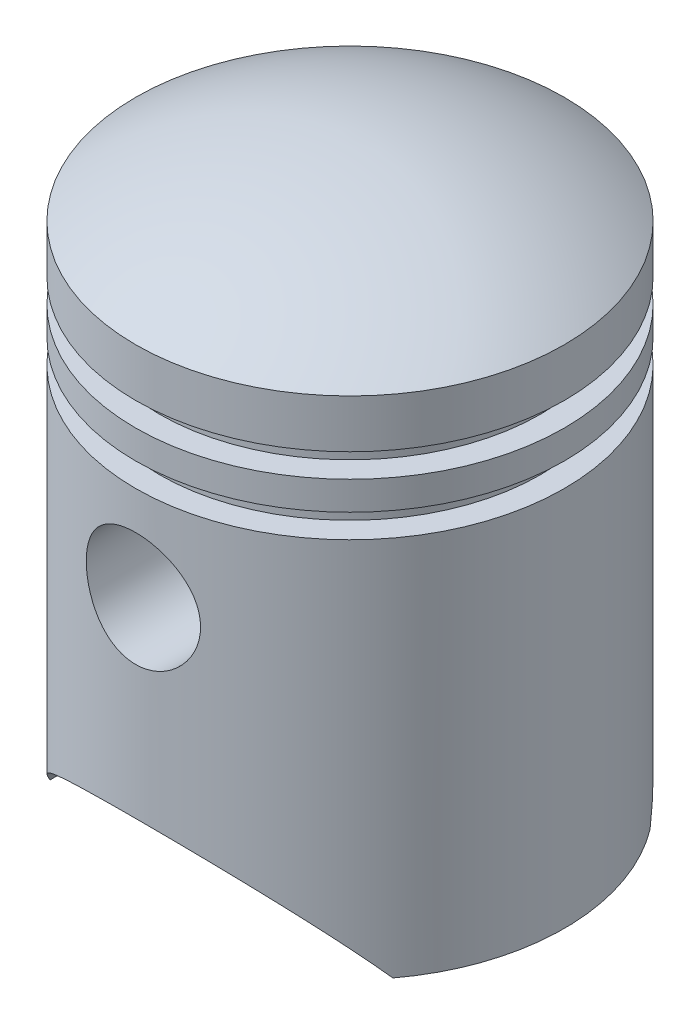
from build123d import *

# Parameters (mm, degrees)
SZKIC3_W                         = 2.5
SZKIC3_H                         = 2.5
SZYK_LINIOWY1_COUNT              = 2
SZYK_LINIOWY1_PITCH              = 5.5
WYTNIJ_WYCI_GNI_CIE1_DEPTH       = 68.915388536
WYTNIJ_WYCI_GNI_CIE1_DEPTH_BACK  = 68.915388536
WYTNIJ_WYCI_GNI_CIE3_DEPTH       = 68.915388602
WYTNIJ_WYCI_GNI_CIE3_DEPTH_BACK  = 68.915388602
SZKIC5_R                         = 6
DODANIE_WYCI_GNI_CIE1_REACH      = 79.915
DODANIE_WYCI_GNI_CIE1_END_RADIUS = 20.5
DODANIE_WYCI_GNI_CIE1_START      = 10
SZKIC6_R                         = 7.5
SZKIC6_R_2                       = 6


# Read off the part's stored shape, not the designer's step: Skorupa1
with BuildPart() as part:
    # Szkic1 → Obrót1 (revolve)
    with BuildSketch(Plane.XY):
        with BuildLine():
            Line((0, 0), (0, 60))
            ThreePointArc((0, 60), (11.771243445, 58.228756555), (22.5, 53.071891388))
            Line((22.5, 53.071891388), (22.5, 0))
            Line((22.5, 0), (0, 0))
        make_face()
    revolve(axis=Axis((0, 0, 0), (0, 1, 0)))

    # Szkic3 → Wycięcie-obrót1 (revolve, cut)
    with BuildSketch(Plane.XY, mode=Mode.PRIVATE) as wyci_cie_obr_t1_sk:
        with Locations((21.25, 41.25)):
            Rectangle(SZKIC3_W, SZKIC3_H)
    wyci_cie_obr_t1 = revolve(wyci_cie_obr_t1_sk.sketch.rotate(Axis((0, 69.339068265, 0), (0, 1, 0)), 90), axis=Axis((0, 69.339068265, 0), (0, 1, 0)), mode=Mode.SUBTRACT)

    # Szyk liniowy1: Wycięcie-obrót1 ×2
    with Locations(*[(0, i * SZYK_LINIOWY1_PITCH, 0) for i in range(1, SZYK_LINIOWY1_COUNT)]):
        add(wyci_cie_obr_t1, mode=Mode.SUBTRACT)

    # Skorupa1 outline → Skorupa1 (revolve, cut)
    with BuildSketch(Plane.XY):
        with BuildLine():
            Line((20.5, 0), (20.5, 38))
            Line((20.5, 38), (18, 38))
            Line((18, 38), (18, 50))
            Line((18, 50), (20.5, 50))
            Line((20.5, 50), (20.500000011, 51.996093505))
            ThreePointArc((20.500000011, 51.996093505), (10.680553516, 56.468147425), (0, 58))
            Line((0, 58), (0, 0))
            Line((0, 0), (20.5, 0))
        make_face()
    revolve(axis=Axis((0, 0, 0), (0, 1, 0)), mode=Mode.SUBTRACT)

    # Szkic4 → Wytnij-wyciągnięcie1 (cut, two sides: drawn at the far end of the back side and taken through both)
    with BuildSketch(Plane.XY.offset(-WYTNIJ_WYCI_GNI_CIE1_DEPTH_BACK)):
        with BuildLine():
            Line((-99.770112831, -131.416252764), (-18, 0))
            ThreePointArc((-18, 0), (0, 10), (18, 0))
            Line((18, 0), (99.770112831, -131.416252764))
            Line((99.770112831, -131.416252764), (99.770112831, -440.974537052))
            Line((99.770112831, -440.974537052), (-99.770112831, -440.974537052))
            Line((-99.770112831, -440.974537052), (-99.770112831, -131.416252764))
        make_face()
    extrude(amount=WYTNIJ_WYCI_GNI_CIE1_DEPTH + WYTNIJ_WYCI_GNI_CIE1_DEPTH_BACK, mode=Mode.SUBTRACT)

    # Szkic5 → Wytnij-wyciągnięcie3 (cut, two sides: drawn at the far end of the back side and taken through both)
    with BuildSketch(Plane.XY.offset(-WYTNIJ_WYCI_GNI_CIE3_DEPTH_BACK)):
        with Locations((0, 30)):
            Circle(SZKIC5_R)
    extrude(amount=WYTNIJ_WYCI_GNI_CIE3_DEPTH + WYTNIJ_WYCI_GNI_CIE3_DEPTH_BACK, mode=Mode.SUBTRACT)

    # Dodanie-wyciągnięcie1: up to this cylinder (the profile starts inside it)
    dodanie_wyci_gni_cie1_end = Plane(origin=(0, 30, 0), z_dir=(0, -1, 0)) * Cylinder(DODANIE_WYCI_GNI_CIE1_END_RADIUS, 201.83, mode=Mode.PRIVATE)
    # Szkic6 → Dodanie-wyciągnięcie1 (add, up to the surface)
    with BuildSketch(Plane.XY.offset(DODANIE_WYCI_GNI_CIE1_START), mode=Mode.PRIVATE) as dodanie_wyci_gni_cie1_sk1:
        with Locations(Location((0, 30, 0), (0, 0, 180))):
            Circle(SZKIC6_R)
        with Locations((0, 30)):
            Circle(SZKIC6_R_2, mode=Mode.SUBTRACT)
    dodanie_wyci_gni_cie1_tool1 = extrude(dodanie_wyci_gni_cie1_sk1.sketch, amount=DODANIE_WYCI_GNI_CIE1_REACH, mode=Mode.PRIVATE) & dodanie_wyci_gni_cie1_end
    dodanie_wyci_gni_cie1 = dodanie_wyci_gni_cie1_tool1.solids().sort_by_distance((7.287868, 30, 10))[0]
    add(dodanie_wyci_gni_cie1)

    # Lustro1: Dodanie-wyciągnięcie1 across plane
    add(dodanie_wyci_gni_cie1.mirror(Plane.XY))


solid = part.part
